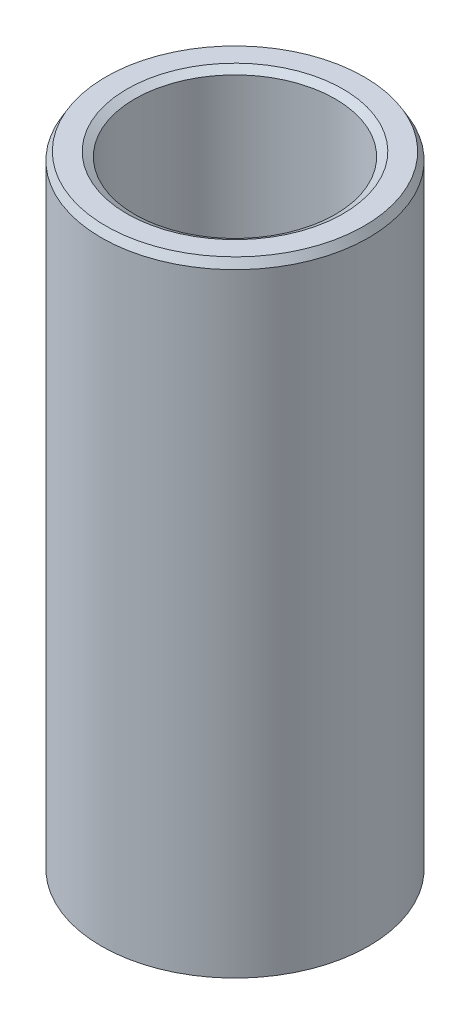
from build123d import *
from OCP.BRepFilletAPI import BRepFilletAPI_MakeChamfer

# Parameters (mm, degrees)
SKETCH1_R           = 55
BOSS_EXTRUDE1_DEPTH = 257.428573879
SKETCH2_R           = 41.203907943
CUT_EXTRUDE1_DEPTH  = 269.92279682
CHAMFER1_SIZE       = 3.241721618
CHAMFER1_SIZE2      = 1.871608849


with BuildPart() as part:
    # Sketch1 → Boss-Extrude1 (new body)
    with BuildSketch(Plane(origin=(0, 0, 0), x_dir=(1, 0, 0), z_dir=(0, 1, 0))):
        Circle(SKETCH1_R)
    extrude(amount=BOSS_EXTRUDE1_DEPTH)

    # Sketch2 → Cut-Extrude1 (cut, through all)
    with BuildSketch(Plane(origin=(0, 0, 0), x_dir=(1, 0, 0), z_dir=(0, 1, 0))):
        Circle(SKETCH2_R)
    extrude(amount=CUT_EXTRUDE1_DEPTH, mode=Mode.SUBTRACT)

    # Chamfer1: one chamfer whose edges measure the first distance from different faces: ONE call of the kernel's chamfer builder (chamfer() names one face for all edges)
    chamfer1_edges_1 = [part.edges().sort_by_distance(p)[0] for p in [
        (-41.203907943, 257.428573879, 0),
    ]]
    chamfer1_side_1 = [part.faces().sort_by_distance(p)[0] for p in [
        (-53.444365081, 257.428573879, 0),
    ]]
    chamfer1_edges_2 = [part.edges().sort_by_distance(p)[0] for p in [
        (-41.203907943, 0, 0),
    ]]
    chamfer1_side_2 = [part.faces().sort_by_distance(p)[0] for p in [
        (-41.203907943, 128.71428694, 0),
    ]]
    chamfer1_edges_3 = [part.edges().sort_by_distance(p)[0] for p in [
        (-55, 0, 0),
    ]]
    chamfer1_side_3 = [part.faces().sort_by_distance(p)[0] for p in [
        (-53.444365081, 0, 0),
    ]]
    chamfer1_edges_4 = [part.edges().sort_by_distance(p)[0] for p in [
        (-55, 257.428573879, 0),
    ]]
    chamfer1_side_4 = [part.faces().sort_by_distance(p)[0] for p in [
        (-55, 128.71428694, 0),
    ]]
    chamfer1 = BRepFilletAPI_MakeChamfer(part.part.solid().wrapped)
    for e in chamfer1_edges_1:
        chamfer1.Add(CHAMFER1_SIZE, CHAMFER1_SIZE2, e.wrapped, chamfer1_side_1[0].wrapped)  # the first distance lies on this face
    for e in chamfer1_edges_2:
        chamfer1.Add(CHAMFER1_SIZE, CHAMFER1_SIZE2, e.wrapped, chamfer1_side_2[0].wrapped)  # the first distance lies on this face
    for e in chamfer1_edges_3:
        chamfer1.Add(CHAMFER1_SIZE, CHAMFER1_SIZE2, e.wrapped, chamfer1_side_3[0].wrapped)  # the first distance lies on this face
    for e in chamfer1_edges_4:
        chamfer1.Add(CHAMFER1_SIZE, CHAMFER1_SIZE2, e.wrapped, chamfer1_side_4[0].wrapped)  # the first distance lies on this face
    add(Compound.cast(chamfer1.Shape()), mode=Mode.REPLACE)


solid = part.part
